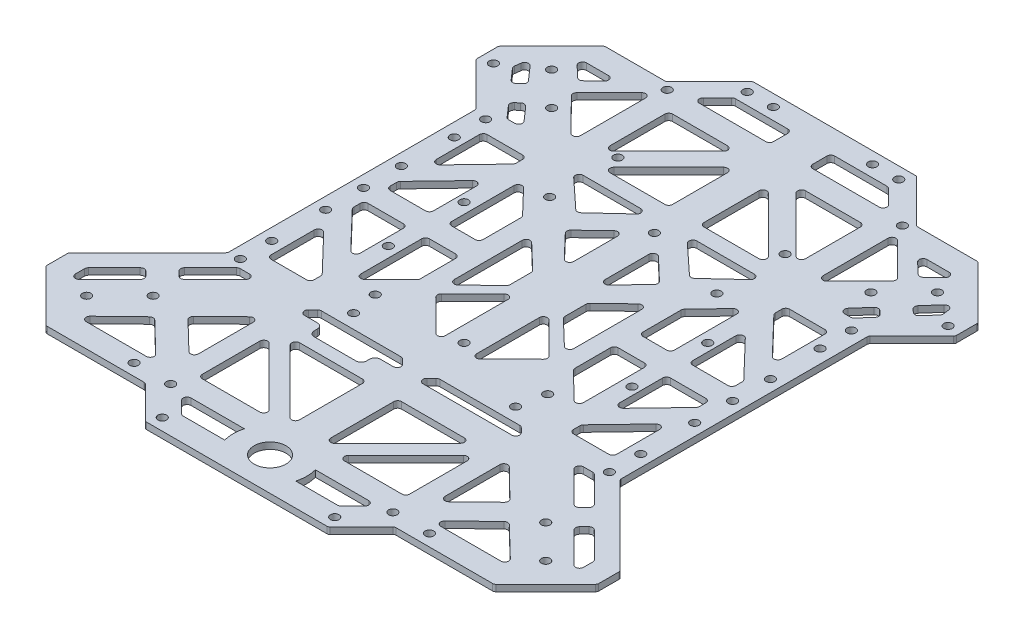
from build123d import *

# Parameters (mm, degrees)
Y_KSEKLIK_EKSTR_ZYON2_DEPTH = 2.5
IZIM2_R                     = 1.65
KES_EKSTR_ZYON1_DEPTH       = 160.16888056
RADYUS1_R                   = 1.17
Y_KSEKLIK_EKSTR_ZYON3_START = -2.5
Y_KSEKLIK_EKSTR_ZYON3_DEPTH = 2.5
IZIM6_R                     = 1.65
KES_EKSTR_ZYON3_DEPTH       = 160.16888056
RADYUS2_R                   = 1.5
KES_EKSTR_ZYON4_DEPTH       = 160.16888056
RADYUS3_R                   = 2
Y_KSEKLIK_EKSTR_ZYON5_START = -2.5
IZIM8_R                     = 6.1
Y_KSEKLIK_EKSTR_ZYON5_DEPTH = 2.5
IZIM9_R                     = 6.1
KES_EKSTR_ZYON5_DEPTH       = 160.16888056


with BuildPart() as part:
    # Çizim1 → Yükseklik-Ekstrüzyon2 (new body)
    with BuildSketch(Plane(origin=(0, 0, 0), x_dir=(1, 0, 0), z_dir=(0, 1, 0))):
        Polygon((105.526911935, -77.905591591), (75.121320344, -47.5), (75.121320344, 0), (75.121320344, 47.5), (91.738329701, 64.117009358), (91.738329701, 72.817009358), (71.444365081, 93.110973978), (47.944365081, 93.110973978), (31.327355724, 109.727983336), (-31.327355724, 109.727983336), (-47.944365081, 93.110973978), (-71.444365081, 93.110973978), (-91.738329701, 72.817009358), (-91.738329701, 64.117009358), (-75.121320344, 47.5), (-75.121320344, 0), (-75.121320344, -47.5), (-105.526911935, -77.905591591), (-105.526911935, -86.605591591), (-85.727922061, -106.404581464), (-47.727922061, -106.404581464), (-35, -119.132503526), (35, -119.132503526), (47.727922061, -106.404581464), (85.727922061, -106.404581464), (105.526911935, -86.605591591), align=None)
        with BuildLine():
            Line((6, -104.132503526), (6, -108.632503526))
            ThreePointArc((6, -108.632503526), (6.439339828, -109.693163697), (7.5, -110.132503526))
            Line((7.5, -110.132503526), (29.5, -110.132503526))
            ThreePointArc((29.5, -110.132503526), (30.074025149, -110.018322824), (30.560660172, -109.693163697))
            Line((30.560660172, -109.693163697), (35.060660172, -105.193163697))
            ThreePointArc((35.060660172, -105.193163697), (35.385819299, -103.558478377), (34, -102.632503526))
            Line((34, -102.632503526), (7.5, -102.632503526))
            ThreePointArc((7.5, -102.632503526), (6.439339828, -103.071843354), (6, -104.132503526))
        make_face(mode=Mode.SUBTRACT)
        with BuildLine():
            Line((39.693257197, -70.632503526), (39.693257197, -92.632503526))
            ThreePointArc((39.693257197, -92.632503526), (39.253917369, -93.693163697), (38.193257197, -94.132503526))
            Line((38.193257197, -94.132503526), (16.193257197, -94.132503526))
            ThreePointArc((16.193257197, -94.132503526), (14.807437899, -93.206528674), (15.132597026, -91.571843354))
            Line((15.132597026, -91.571843354), (37.132597026, -69.571843354))
            ThreePointArc((37.132597026, -69.571843354), (38.767282346, -69.246684227), (39.693257197, -70.632503526))
        make_face(mode=Mode.SUBTRACT)
        with BuildLine():
            Line((6, -65.049314368), (6, -89.132503526))
            ThreePointArc((6, -89.132503526), (6.927173874, -90.518818868), (8.562493639, -90.191327055))
            Line((8.562493639, -90.191327055), (32.562493639, -66.108137897))
            ThreePointArc((32.562493639, -66.108137897), (32.885322218, -64.474090626), (31.5, -63.549314368))
            Line((31.5, -63.549314368), (7.5, -63.549314368))
            ThreePointArc((7.5, -63.549314368), (6.439339828, -63.988654196), (6, -65.049314368))
        make_face(mode=Mode.SUBTRACT)
        with BuildLine():
            Line((66.811266381, -83.702158734), (55.311266381, -94.826456464))
            ThreePointArc((55.311266381, -94.826456464), (54.963632077, -96.467081464), (56.354169294, -97.404581464))
            Line((56.354169294, -97.404581464), (79.354169294, -97.404581464))
            ThreePointArc((79.354169294, -97.404581464), (80.74470651, -96.467081464), (80.397072206, -94.826456464))
            Line((80.397072206, -94.826456464), (68.897072206, -83.702158734))
            ThreePointArc((68.897072206, -83.702158734), (67.854169294, -83.280283734), (66.811266381, -83.702158734))
        make_face(mode=Mode.SUBTRACT)
        with BuildLine():
            Line((49.73616011, -87.697686208), (60.51741011, -77.268657085))
            ThreePointArc((60.51741011, -77.268657085), (60.974498637, -76.195599689), (60.524670942, -75.119478347))
            Line((60.524670942, -75.119478347), (49.743420942, -64.54850747))
            ThreePointArc((49.743420942, -64.54850747), (48.112415402, -64.236585138), (47.193257197, -65.619561208))
            Line((47.193257197, -65.619561208), (47.193257197, -86.619561208))
            ThreePointArc((47.193257197, -86.619561208), (48.107746467, -88.000567067), (49.73616011, -87.697686208))
        make_face(mode=Mode.SUBTRACT)
        with BuildLine():
            Line((21.634440051, -34.045740022), (4.634440051, -50.986814368))
            ThreePointArc((4.634440051, -50.986814368), (4.306940134, -52.62213633), (5.693257197, -53.549314368))
            Line((5.693257197, -53.549314368), (39.693257197, -53.549314368))
            ThreePointArc((39.693257197, -53.549314368), (41.079574261, -52.62213633), (40.752074344, -50.986814368))
            Line((40.752074344, -50.986814368), (23.752074344, -34.045740022))
            ThreePointArc((23.752074344, -34.045740022), (22.693257197, -33.608240022), (21.634440051, -34.045740022))
        make_face(mode=Mode.SUBTRACT)
        with BuildLine():
            Line((6, -9.30780183), (6, -33.30780183))
            ThreePointArc((6, -33.30780183), (6.924776258, -34.693124048), (8.558823529, -34.370295469))
            Line((8.558823529, -34.370295469), (20.600418108, -22.370295469))
            ThreePointArc((20.600418108, -22.370295469), (21.041594579, -21.30780183), (20.600418108, -20.245308191))
            Line((20.600418108, -20.245308191), (8.558823529, -8.245308191))
            ThreePointArc((8.558823529, -8.245308191), (6.924776258, -7.922479612), (6, -9.30780183))
        make_face(mode=Mode.SUBTRACT)
        with BuildLine():
            Line((10.5, 4), (10.5, -4))
            ThreePointArc((10.5, -4), (10.620200683, -4.588348405), (10.961538462, -5.082403637))
            Line((10.961538462, -5.082403637), (20.342369981, -14.082403637))
            ThreePointArc((20.342369981, -14.082403637), (21.969179925, -14.379799317), (22.88083152, -13))
            Line((22.88083152, -13), (22.88083152, 13))
            ThreePointArc((22.88083152, 13), (21.969179925, 14.379799317), (20.342369981, 14.082403637))
            Line((20.342369981, 14.082403637), (10.961538462, 5.082403637))
            ThreePointArc((10.961538462, 5.082403637), (10.620200683, 4.588348405), (10.5, 4))
        make_face(mode=Mode.SUBTRACT)
        with BuildLine():
            Line((84.774621202, -69.174116139), (83.006854249, -70.941883092))
            ThreePointArc((83.006854249, -70.941883092), (82.567514421, -72.002543264), (83.006854249, -73.063203436))
            Line((83.006854249, -73.063203436), (94.674116139, -84.730465325))
            ThreePointArc((94.674116139, -84.730465325), (96.308801459, -85.055624452), (97.234776311, -83.669805153))
            Line((97.234776311, -83.669805153), (97.234776311, -80.134271247))
            ThreePointArc((97.234776311, -80.134271247), (97.12059561, -79.560246099), (96.795436483, -79.073611076))
            Line((96.795436483, -79.073611076), (86.895941546, -69.174116139))
            ThreePointArc((86.895941546, -69.174116139), (85.835281374, -68.734776311), (84.774621202, -69.174116139))
        make_face(mode=Mode.SUBTRACT)
        with BuildLine():
            Line((63.914971157, -50.35), (67.450505063, -50.35))
            ThreePointArc((67.450505063, -50.35), (68.024530212, -50.464180701), (68.511165235, -50.789339828))
            Line((68.511165235, -50.789339828), (78.410660172, -60.688834765))
            ThreePointArc((78.410660172, -60.688834765), (78.85, -61.749494937), (78.410660172, -62.810155108))
            Line((78.410660172, -62.810155108), (76.642893219, -64.577922061))
            ThreePointArc((76.642893219, -64.577922061), (75.582233047, -65.01726189), (74.521572875, -64.577922061))
            Line((74.521572875, -64.577922061), (62.854310986, -52.910660172))
            ThreePointArc((62.854310986, -52.910660172), (62.529151859, -51.275974851), (63.914971157, -50.35))
        make_face(mode=Mode.SUBTRACT)
        with BuildLine():
            Line((51.121320344, -41.35), (64.621320344, -41.35))
            ThreePointArc((64.621320344, -41.35), (65.681980515, -40.910660172), (66.121320344, -39.85))
            Line((66.121320344, -39.85), (66.121320344, -23.35))
            ThreePointArc((66.121320344, -23.35), (65.18096065, -21.958309399), (63.538916707, -22.311538462))
            Line((63.538916707, -22.311538462), (50.038916707, -36.382785741))
            ThreePointArc((50.038916707, -36.382785741), (49.729629743, -36.861606973), (49.621320344, -37.421247279))
            Line((49.621320344, -37.421247279), (49.621320344, -39.85))
            ThreePointArc((49.621320344, -39.85), (50.060660172, -40.910660172), (51.121320344, -41.35))
        make_face(mode=Mode.SUBTRACT)
        with BuildLine():
            Line((49.621320344, -5.754580613), (49.621320344, -22.254580613))
            ThreePointArc((49.621320344, -22.254580613), (50.561680037, -23.646271213), (52.20372398, -23.293042151))
            Line((52.20372398, -23.293042151), (65.70372398, -9.221794872))
            ThreePointArc((65.70372398, -9.221794872), (66.013010944, -8.74297364), (66.121320344, -8.183333333))
            Line((66.121320344, -8.183333333), (66.121320344, -5.754580613))
            ThreePointArc((66.121320344, -5.754580613), (65.681980515, -4.693920441), (64.621320344, -4.254580613))
            Line((64.621320344, -4.254580613), (51.121320344, -4.254580613))
            ThreePointArc((51.121320344, -4.254580613), (50.060660172, -4.693920441), (49.621320344, -5.754580613))
        make_face(mode=Mode.SUBTRACT)
        with BuildLine():
            Line((29.621320344, -5.75), (29.621320344, -19.25))
            ThreePointArc((29.621320344, -19.25), (29.738447975, -19.831088643), (30.071539025, -20.321428571))
            Line((30.071539025, -20.321428571), (40.071539025, -30.119387543))
            ThreePointArc((40.071539025, -30.119387543), (41.702408987, -30.43083134), (42.621320344, -29.047958971))
            Line((42.621320344, -29.047958971), (42.621320344, -5.75))
            ThreePointArc((42.621320344, -5.75), (42.181980515, -4.689339828), (41.121320344, -4.25))
            Line((41.121320344, -4.25), (31.121320344, -4.25))
            ThreePointArc((31.121320344, -4.25), (30.060660172, -4.689339828), (29.621320344, -5.75))
        make_face(mode=Mode.SUBTRACT)
        with BuildLine():
            Line((-41.121320344, -4.25), (-31.121320344, -4.25))
            ThreePointArc((-31.121320344, -4.25), (-30.060660172, -4.689339828), (-29.621320344, -5.75))
            Line((-29.621320344, -5.75), (-29.621320344, -19.25))
            ThreePointArc((-29.621320344, -19.25), (-29.738447975, -19.831088643), (-30.071539025, -20.321428571))
            Line((-30.071539025, -20.321428571), (-40.071539025, -30.119387543))
            ThreePointArc((-40.071539025, -30.119387543), (-41.702408987, -30.43083134), (-42.621320344, -29.047958971))
            Line((-42.621320344, -29.047958971), (-42.621320344, -5.75))
            ThreePointArc((-42.621320344, -5.75), (-42.181980515, -4.689339828), (-41.121320344, -4.25))
        make_face(mode=Mode.SUBTRACT)
        with BuildLine():
            Line((-64.621320344, -4.254580613), (-51.121320344, -4.254580613))
            ThreePointArc((-51.121320344, -4.254580613), (-50.060660172, -4.693920441), (-49.621320344, -5.754580613))
            Line((-49.621320344, -5.754580613), (-49.621320344, -22.254580613))
            ThreePointArc((-49.621320344, -22.254580613), (-50.561680037, -23.646271213), (-52.20372398, -23.293042151))
            Line((-52.20372398, -23.293042151), (-65.70372398, -9.221794872))
            ThreePointArc((-65.70372398, -9.221794872), (-66.013010944, -8.74297364), (-66.121320344, -8.183333333))
            Line((-66.121320344, -8.183333333), (-66.121320344, -5.754580613))
            ThreePointArc((-66.121320344, -5.754580613), (-65.681980515, -4.693920441), (-64.621320344, -4.254580613))
        make_face(mode=Mode.SUBTRACT)
        with BuildLine():
            Line((-49.621320344, -37.421247279), (-49.621320344, -39.85))
            ThreePointArc((-49.621320344, -39.85), (-50.060660172, -40.910660172), (-51.121320344, -41.35))
            Line((-51.121320344, -41.35), (-64.621320344, -41.35))
            ThreePointArc((-64.621320344, -41.35), (-65.681980515, -40.910660172), (-66.121320344, -39.85))
            Line((-66.121320344, -39.85), (-66.121320344, -23.35))
            ThreePointArc((-66.121320344, -23.35), (-65.18096065, -21.958309399), (-63.538916707, -22.311538462))
            Line((-63.538916707, -22.311538462), (-50.038916707, -36.382785741))
            ThreePointArc((-50.038916707, -36.382785741), (-49.729629743, -36.861606973), (-49.621320344, -37.421247279))
        make_face(mode=Mode.SUBTRACT)
        with BuildLine():
            Line((-68.511165235, -50.789339828), (-78.410660172, -60.688834765))
            ThreePointArc((-78.410660172, -60.688834765), (-78.85, -61.749494937), (-78.410660172, -62.810155108))
            Line((-78.410660172, -62.810155108), (-76.642893219, -64.577922061))
            ThreePointArc((-76.642893219, -64.577922061), (-75.582233047, -65.01726189), (-74.521572875, -64.577922061))
            Line((-74.521572875, -64.577922061), (-62.854310986, -52.910660172))
            ThreePointArc((-62.854310986, -52.910660172), (-62.529151859, -51.275974851), (-63.914971157, -50.35))
            Line((-63.914971157, -50.35), (-67.450505063, -50.35))
            ThreePointArc((-67.450505063, -50.35), (-68.024530212, -50.464180701), (-68.511165235, -50.789339828))
        make_face(mode=Mode.SUBTRACT)
        with BuildLine():
            Line((-96.795436483, -79.073611076), (-86.895941546, -69.174116139))
            ThreePointArc((-86.895941546, -69.174116139), (-85.835281374, -68.734776311), (-84.774621202, -69.174116139))
            Line((-84.774621202, -69.174116139), (-83.006854249, -70.941883092))
            ThreePointArc((-83.006854249, -70.941883092), (-82.567514421, -72.002543264), (-83.006854249, -73.063203436))
            Line((-83.006854249, -73.063203436), (-94.674116139, -84.730465325))
            ThreePointArc((-94.674116139, -84.730465325), (-96.308801459, -85.055624452), (-97.234776311, -83.669805153))
            Line((-97.234776311, -83.669805153), (-97.234776311, -80.134271247))
            ThreePointArc((-97.234776311, -80.134271247), (-97.12059561, -79.560246099), (-96.795436483, -79.073611076))
        make_face(mode=Mode.SUBTRACT)
        with BuildLine():
            Line((-10.961538462, -5.082403637), (-20.342369981, -14.082403637))
            ThreePointArc((-20.342369981, -14.082403637), (-21.969179925, -14.379799317), (-22.88083152, -13))
            Line((-22.88083152, -13), (-22.88083152, 13))
            ThreePointArc((-22.88083152, 13), (-21.969179925, 14.379799317), (-20.342369981, 14.082403637))
            Line((-20.342369981, 14.082403637), (-10.961538462, 5.082403637))
            ThreePointArc((-10.961538462, 5.082403637), (-10.620200683, 4.588348405), (-10.5, 4))
            Line((-10.5, 4), (-10.5, -4))
            ThreePointArc((-10.5, -4), (-10.620200683, -4.588348405), (-10.961538462, -5.082403637))
        make_face(mode=Mode.SUBTRACT)
        with BuildLine():
            Line((-20.600418108, -20.245308191), (-8.558823529, -8.245308191))
            ThreePointArc((-8.558823529, -8.245308191), (-6.924776258, -7.922479612), (-6, -9.30780183))
            Line((-6, -9.30780183), (-6, -33.30780183))
            ThreePointArc((-6, -33.30780183), (-6.924776258, -34.693124048), (-8.558823529, -34.370295469))
            Line((-8.558823529, -34.370295469), (-20.600418108, -22.370295469))
            ThreePointArc((-20.600418108, -22.370295469), (-21.041594579, -21.30780183), (-20.600418108, -20.245308191))
        make_face(mode=Mode.SUBTRACT)
        with BuildLine():
            Line((-40.752074344, -50.986814368), (-23.752074344, -34.045740022))
            ThreePointArc((-23.752074344, -34.045740022), (-22.693257197, -33.608240022), (-21.634440051, -34.045740022))
            Line((-21.634440051, -34.045740022), (-4.634440051, -50.986814368))
            ThreePointArc((-4.634440051, -50.986814368), (-4.306940134, -52.62213633), (-5.693257197, -53.549314368))
            Line((-5.693257197, -53.549314368), (-39.693257197, -53.549314368))
            ThreePointArc((-39.693257197, -53.549314368), (-41.079574261, -52.62213633), (-40.752074344, -50.986814368))
        make_face(mode=Mode.SUBTRACT)
        with BuildLine():
            Line((-47.193257197, -65.619561208), (-47.193257197, -86.619561208))
            ThreePointArc((-47.193257197, -86.619561208), (-48.107746467, -88.000567067), (-49.73616011, -87.697686208))
            Line((-49.73616011, -87.697686208), (-60.51741011, -77.268657085))
            ThreePointArc((-60.51741011, -77.268657085), (-60.974498637, -76.195599689), (-60.524670942, -75.119478347))
            Line((-60.524670942, -75.119478347), (-49.743420942, -64.54850747))
            ThreePointArc((-49.743420942, -64.54850747), (-48.112415402, -64.236585138), (-47.193257197, -65.619561208))
        make_face(mode=Mode.SUBTRACT)
        with BuildLine():
            Line((-80.397072206, -94.826456464), (-68.897072206, -83.702158734))
            ThreePointArc((-68.897072206, -83.702158734), (-67.854169294, -83.280283734), (-66.811266381, -83.702158734))
            Line((-66.811266381, -83.702158734), (-55.311266381, -94.826456464))
            ThreePointArc((-55.311266381, -94.826456464), (-54.963632077, -96.467081464), (-56.354169294, -97.404581464))
            Line((-56.354169294, -97.404581464), (-79.354169294, -97.404581464))
            ThreePointArc((-79.354169294, -97.404581464), (-80.74470651, -96.467081464), (-80.397072206, -94.826456464))
        make_face(mode=Mode.SUBTRACT)
        with BuildLine():
            Line((-31.5, -63.549314368), (-7.5, -63.549314368))
            ThreePointArc((-7.5, -63.549314368), (-6.439339828, -63.988654196), (-6, -65.049314368))
            Line((-6, -65.049314368), (-6, -89.132503526))
            ThreePointArc((-6, -89.132503526), (-6.927173874, -90.518818868), (-8.562493639, -90.191327055))
            Line((-8.562493639, -90.191327055), (-32.562493639, -66.108137897))
            ThreePointArc((-32.562493639, -66.108137897), (-32.885322218, -64.474090626), (-31.5, -63.549314368))
        make_face(mode=Mode.SUBTRACT)
        with BuildLine():
            Line((-15.132597026, -91.571843354), (-37.132597026, -69.571843354))
            ThreePointArc((-37.132597026, -69.571843354), (-38.767282346, -69.246684227), (-39.693257197, -70.632503526))
            Line((-39.693257197, -70.632503526), (-39.693257197, -92.632503526))
            ThreePointArc((-39.693257197, -92.632503526), (-39.253917369, -93.693163697), (-38.193257197, -94.132503526))
            Line((-38.193257197, -94.132503526), (-16.193257197, -94.132503526))
            ThreePointArc((-16.193257197, -94.132503526), (-14.807437899, -93.206528674), (-15.132597026, -91.571843354))
        make_face(mode=Mode.SUBTRACT)
        with BuildLine():
            Line((-34, -102.632503526), (-7.5, -102.632503526))
            ThreePointArc((-7.5, -102.632503526), (-6.439339828, -103.071843354), (-6, -104.132503526))
            Line((-6, -104.132503526), (-6, -108.632503526))
            ThreePointArc((-6, -108.632503526), (-6.439339828, -109.693163697), (-7.5, -110.132503526))
            Line((-7.5, -110.132503526), (-29.5, -110.132503526))
            ThreePointArc((-29.5, -110.132503526), (-30.074025149, -110.018322824), (-30.560660172, -109.693163697))
            Line((-30.560660172, -109.693163697), (-35.060660172, -105.193163697))
            ThreePointArc((-35.060660172, -105.193163697), (-35.385819299, -103.558478377), (-34, -102.632503526))
        make_face(mode=Mode.SUBTRACT)
        with BuildLine():
            Line((63.538916707, 22.311538462), (50.038916707, 36.382785741))
            ThreePointArc((50.038916707, 36.382785741), (49.729629743, 36.861606973), (49.621320344, 37.421247279))
            Line((49.621320344, 37.421247279), (49.621320344, 39.85))
            ThreePointArc((49.621320344, 39.85), (50.060660172, 40.910660172), (51.121320344, 41.35))
            Line((51.121320344, 41.35), (64.621320344, 41.35))
            ThreePointArc((64.621320344, 41.35), (65.681980515, 40.910660172), (66.121320344, 39.85))
            Line((66.121320344, 39.85), (66.121320344, 23.35))
            ThreePointArc((66.121320344, 23.35), (65.18096065, 21.958309399), (63.538916707, 22.311538462))
        make_face(mode=Mode.SUBTRACT)
        with BuildLine():
            Line((66.121320344, 8.183333333), (66.121320344, 5.754580613))
            ThreePointArc((66.121320344, 5.754580613), (65.681980515, 4.693920441), (64.621320344, 4.254580613))
            Line((64.621320344, 4.254580613), (51.121320344, 4.254580613))
            ThreePointArc((51.121320344, 4.254580613), (50.060660172, 4.693920441), (49.621320344, 5.754580613))
            Line((49.621320344, 5.754580613), (49.621320344, 22.254580613))
            ThreePointArc((49.621320344, 22.254580613), (50.561680037, 23.646271213), (52.20372398, 23.293042151))
            Line((52.20372398, 23.293042151), (65.70372398, 9.221794872))
            ThreePointArc((65.70372398, 9.221794872), (66.013010944, 8.74297364), (66.121320344, 8.183333333))
        make_face(mode=Mode.SUBTRACT)
        with BuildLine():
            Line((41.121320344, 4.254580613), (32.121320344, 4.254580613))
            ThreePointArc((32.121320344, 4.254580613), (31.060660172, 4.693920441), (30.621320344, 5.754580613))
            Line((30.621320344, 5.754580613), (30.621320344, 20.254580613))
            ThreePointArc((30.621320344, 20.254580613), (30.729629743, 20.814220919), (31.038916707, 21.293042151))
            Line((31.038916707, 21.293042151), (40.038916707, 30.673873671))
            ThreePointArc((40.038916707, 30.673873671), (41.68096065, 31.027102733), (42.621320344, 29.635412132))
            Line((42.621320344, 29.635412132), (42.621320344, 5.754580613))
            ThreePointArc((42.621320344, 5.754580613), (42.181980515, 4.693920441), (41.121320344, 4.254580613))
        make_face(mode=Mode.SUBTRACT)
        with BuildLine():
            Line((62.002327364, 52.842432456), (66.633678823, 58.091297443))
            ThreePointArc((66.633678823, 58.091297443), (67.664868177, 58.595943855), (68.750868062, 58.223621771))
            Line((68.750868062, 58.223621771), (70.025592416, 57.098864988))
            ThreePointArc((70.025592416, 57.098864988), (70.530238828, 56.067675634), (70.157916744, 54.981675749))
            Line((70.157916744, 54.981675749), (66.51899774, 50.857567544))
            ThreePointArc((66.51899774, 50.857567544), (66.011230145, 50.482767634), (65.394240957, 50.35))
            Line((65.394240957, 50.35), (63.127084147, 50.35))
            ThreePointArc((63.127084147, 50.35), (61.759851781, 51.233010812), (62.002327364, 52.842432456))
        make_face(mode=Mode.SUBTRACT)
        with BuildLine():
            Line((78.097376389, 63.979730013), (81.736295393, 68.103838218))
            ThreePointArc((81.736295393, 68.103838218), (82.044954591, 68.654322007), (82.099865458, 69.283041101))
            Line((82.099865458, 69.283041101), (81.817573559, 71.532554668))
            ThreePointArc((81.817573559, 71.532554668), (80.771195378, 72.779200221), (79.204489928, 72.338216695))
            Line((79.204489928, 72.338216695), (74.573138468, 67.089351708))
            ThreePointArc((74.573138468, 67.089351708), (74.200816384, 66.003351823), (74.705462796, 64.972162469))
            Line((74.705462796, 64.972162469), (75.98018715, 63.847405686))
            ThreePointArc((75.98018715, 63.847405686), (77.066187035, 63.475083601), (78.097376389, 63.979730013))
        make_face(mode=Mode.SUBTRACT)
        with BuildLine():
            Line((60.957864376, 84.110973978), (69.357864376, 84.110973978))
            ThreePointArc((69.357864376, 84.110973978), (70.750579413, 83.168059992), (70.392347135, 81.524767081))
            Line((70.392347135, 81.524767081), (66.192347135, 77.524767081))
            ThreePointArc((66.192347135, 77.524767081), (65.157864376, 77.110973978), (64.123381618, 77.524767081))
            Line((64.123381618, 77.524767081), (59.923381618, 81.524767081))
            ThreePointArc((59.923381618, 81.524767081), (59.56514934, 83.168059992), (60.957864376, 84.110973978))
        make_face(mode=Mode.SUBTRACT)
        with BuildLine():
            Line((6, 32.635405306), (6, 15.835405306))
            ThreePointArc((6, 15.835405306), (6.942124127, 14.443006473), (8.585032681, 14.79969102))
            Line((8.585032681, 14.79969102), (16.975952079, 23.590167211))
            ThreePointArc((16.975952079, 23.590167211), (17.390513959, 24.660754868), (16.926633684, 25.710914177))
            Line((16.926633684, 25.710914177), (8.535714286, 33.720437987))
            ThreePointArc((8.535714286, 33.720437987), (6.909903156, 34.014457776), (6, 32.635405306))
        make_face(mode=Mode.SUBTRACT)
        with BuildLine():
            Line((9.730196097, 43.598039027), (20.730196097, 33.4))
            ThreePointArc((20.730196097, 33.4), (21.75, 33), (22.769803903, 33.4))
            Line((22.769803903, 33.4), (33.769803903, 43.598039027))
            ThreePointArc((33.769803903, 43.598039027), (34.146424004, 45.245761585), (32.75, 46.198039027))
            Line((32.75, 46.198039027), (10.75, 46.198039027))
            ThreePointArc((10.75, 46.198039027), (9.353575996, 45.245761585), (9.730196097, 43.598039027))
        make_face(mode=Mode.SUBTRACT)
        with BuildLine():
            Line((9, 100.727983336), (29.009416563, 100.727983336))
            ThreePointArc((29.009416563, 100.727983336), (29.584046334, 100.613552037), (30.071001931, 100.287717503))
            Line((30.071001931, 100.287717503), (35.461585368, 94.887717503))
            ThreePointArc((35.461585368, 94.887717503), (35.785568701, 93.253353564), (34.4, 92.327983336))
            Line((34.4, 92.327983336), (9, 92.327983336))
            ThreePointArc((9, 92.327983336), (7.939339828, 92.767323164), (7.5, 93.827983336))
            Line((7.5, 93.827983336), (7.5, 99.227983336))
            ThreePointArc((7.5, 99.227983336), (7.939339828, 100.288643508), (9, 100.727983336))
        make_face(mode=Mode.SUBTRACT)
        with BuildLine():
            Line((6, 74.698039027), (6, 53.698039027))
            ThreePointArc((6, 53.698039027), (6.439339828, 52.637378855), (7.5, 52.198039027))
            Line((7.5, 52.198039027), (28.5, 52.198039027))
            ThreePointArc((28.5, 52.198039027), (29.885819299, 53.124013879), (29.560660172, 54.758699199))
            Line((29.560660172, 54.758699199), (8.560660172, 75.758699199))
            ThreePointArc((8.560660172, 75.758699199), (6.925974851, 76.083858326), (6, 74.698039027))
        make_face(mode=Mode.SUBTRACT)
        with BuildLine():
            Line((37.424621202, 82.12266023), (37.424621202, 61.12266023))
            ThreePointArc((37.424621202, 61.12266023), (36.498646351, 59.736840931), (34.863961031, 60.062000058))
            Line((34.863961031, 60.062000058), (13.863961031, 81.062000058))
            ThreePointArc((13.863961031, 81.062000058), (13.538801904, 82.696685378), (14.924621202, 83.62266023))
            Line((14.924621202, 83.62266023), (35.924621202, 83.62266023))
            ThreePointArc((35.924621202, 83.62266023), (36.985281374, 83.183320401), (37.424621202, 82.12266023))
        make_face(mode=Mode.SUBTRACT)
        with BuildLine():
            Line((46.424621202, 83.724368671), (46.424621202, 58.824368671))
            ThreePointArc((46.424621202, 58.824368671), (47.354807935, 57.436812243), (48.991704989, 57.770171255))
            Line((48.991704989, 57.770171255), (61.36607366, 70.295802584))
            ThreePointArc((61.36607366, 70.295802584), (61.798982954, 71.354556041), (61.359650045, 72.410660172))
            Line((61.359650045, 72.410660172), (48.985281374, 84.785028843))
            ThreePointArc((48.985281374, 84.785028843), (47.350596054, 85.11018797), (46.424621202, 83.724368671))
        make_face(mode=Mode.SUBTRACT)
        with BuildLine():
            Line((-61.359650045, 72.410660172), (-48.985281374, 84.785028843))
            ThreePointArc((-48.985281374, 84.785028843), (-47.350596054, 85.11018797), (-46.424621202, 83.724368671))
            Line((-46.424621202, 83.724368671), (-46.424621202, 58.824368671))
            ThreePointArc((-46.424621202, 58.824368671), (-47.354807935, 57.436812243), (-48.991704989, 57.770171255))
            Line((-48.991704989, 57.770171255), (-61.36607366, 70.295802584))
            ThreePointArc((-61.36607366, 70.295802584), (-61.798982954, 71.354556041), (-61.359650045, 72.410660172))
        make_face(mode=Mode.SUBTRACT)
        with BuildLine():
            Line((-34.863961031, 60.062000058), (-13.863961031, 81.062000058))
            ThreePointArc((-13.863961031, 81.062000058), (-13.538801904, 82.696685378), (-14.924621202, 83.62266023))
            Line((-14.924621202, 83.62266023), (-35.924621202, 83.62266023))
            ThreePointArc((-35.924621202, 83.62266023), (-36.985281374, 83.183320401), (-37.424621202, 82.12266023))
            Line((-37.424621202, 82.12266023), (-37.424621202, 61.12266023))
            ThreePointArc((-37.424621202, 61.12266023), (-36.498646351, 59.736840931), (-34.863961031, 60.062000058))
        make_face(mode=Mode.SUBTRACT)
        with BuildLine():
            Line((-29.560660172, 54.758699199), (-8.560660172, 75.758699199))
            ThreePointArc((-8.560660172, 75.758699199), (-6.925974851, 76.083858326), (-6, 74.698039027))
            Line((-6, 74.698039027), (-6, 53.698039027))
            ThreePointArc((-6, 53.698039027), (-6.439339828, 52.637378855), (-7.5, 52.198039027))
            Line((-7.5, 52.198039027), (-28.5, 52.198039027))
            ThreePointArc((-28.5, 52.198039027), (-29.885819299, 53.124013879), (-29.560660172, 54.758699199))
        make_face(mode=Mode.SUBTRACT)
        with BuildLine():
            Line((-7.5, 93.827983336), (-7.5, 99.227983336))
            ThreePointArc((-7.5, 99.227983336), (-7.939339828, 100.288643508), (-9, 100.727983336))
            Line((-9, 100.727983336), (-29.009416563, 100.727983336))
            ThreePointArc((-29.009416563, 100.727983336), (-29.584046334, 100.613552037), (-30.071001931, 100.287717503))
            Line((-30.071001931, 100.287717503), (-35.461585368, 94.887717503))
            ThreePointArc((-35.461585368, 94.887717503), (-35.785568701, 93.253353564), (-34.4, 92.327983336))
            Line((-34.4, 92.327983336), (-9, 92.327983336))
            ThreePointArc((-9, 92.327983336), (-7.939339828, 92.767323164), (-7.5, 93.827983336))
        make_face(mode=Mode.SUBTRACT)
        with BuildLine():
            Line((-32.75, 46.198039027), (-10.75, 46.198039027))
            ThreePointArc((-10.75, 46.198039027), (-9.353575996, 45.245761585), (-9.730196097, 43.598039027))
            Line((-9.730196097, 43.598039027), (-20.730196097, 33.4))
            ThreePointArc((-20.730196097, 33.4), (-21.75, 33), (-22.769803903, 33.4))
            Line((-22.769803903, 33.4), (-33.769803903, 43.598039027))
            ThreePointArc((-33.769803903, 43.598039027), (-34.146424004, 45.245761585), (-32.75, 46.198039027))
        make_face(mode=Mode.SUBTRACT)
        with BuildLine():
            Line((-16.926633684, 25.710914177), (-8.535714286, 33.720437987))
            ThreePointArc((-8.535714286, 33.720437987), (-6.909903156, 34.014457776), (-6, 32.635405306))
            Line((-6, 32.635405306), (-6, 15.835405306))
            ThreePointArc((-6, 15.835405306), (-6.942124127, 14.443006473), (-8.585032681, 14.79969102))
            Line((-8.585032681, 14.79969102), (-16.975952079, 23.590167211))
            ThreePointArc((-16.975952079, 23.590167211), (-17.390513959, 24.660754868), (-16.926633684, 25.710914177))
        make_face(mode=Mode.SUBTRACT)
        with BuildLine():
            Line((-64.123381618, 77.524767081), (-59.923381618, 81.524767081))
            ThreePointArc((-59.923381618, 81.524767081), (-59.56514934, 83.168059992), (-60.957864376, 84.110973978))
            Line((-60.957864376, 84.110973978), (-69.357864376, 84.110973978))
            ThreePointArc((-69.357864376, 84.110973978), (-70.750579413, 83.168059992), (-70.392347135, 81.524767081))
            Line((-70.392347135, 81.524767081), (-66.192347135, 77.524767081))
            ThreePointArc((-66.192347135, 77.524767081), (-65.157864376, 77.110973978), (-64.123381618, 77.524767081))
        make_face(mode=Mode.SUBTRACT)
        with BuildLine():
            Line((-82.099865458, 69.283041101), (-81.817573559, 71.532554668))
            ThreePointArc((-81.817573559, 71.532554668), (-80.771195378, 72.779200221), (-79.204489928, 72.338216695))
            Line((-79.204489928, 72.338216695), (-74.573138468, 67.089351708))
            ThreePointArc((-74.573138468, 67.089351708), (-74.200816384, 66.003351823), (-74.705462796, 64.972162469))
            Line((-74.705462796, 64.972162469), (-75.98018715, 63.847405686))
            ThreePointArc((-75.98018715, 63.847405686), (-77.066187035, 63.475083601), (-78.097376389, 63.979730013))
            Line((-78.097376389, 63.979730013), (-81.736295393, 68.103838218))
            ThreePointArc((-81.736295393, 68.103838218), (-82.044954591, 68.654322007), (-82.099865458, 69.283041101))
        make_face(mode=Mode.SUBTRACT)
        with BuildLine():
            Line((-42.621320344, 29.635412132), (-42.621320344, 5.754580613))
            ThreePointArc((-42.621320344, 5.754580613), (-42.181980515, 4.693920441), (-41.121320344, 4.254580613))
            Line((-41.121320344, 4.254580613), (-32.121320344, 4.254580613))
            ThreePointArc((-32.121320344, 4.254580613), (-31.060660172, 4.693920441), (-30.621320344, 5.754580613))
            Line((-30.621320344, 5.754580613), (-30.621320344, 20.254580613))
            ThreePointArc((-30.621320344, 20.254580613), (-30.729629743, 20.814220919), (-31.038916707, 21.293042151))
            Line((-31.038916707, 21.293042151), (-40.038916707, 30.673873671))
            ThreePointArc((-40.038916707, 30.673873671), (-41.68096065, 31.027102733), (-42.621320344, 29.635412132))
        make_face(mode=Mode.SUBTRACT)
        with BuildLine():
            Line((-64.621320344, 4.254580613), (-51.121320344, 4.254580613))
            ThreePointArc((-51.121320344, 4.254580613), (-50.060660172, 4.693920441), (-49.621320344, 5.754580613))
            Line((-49.621320344, 5.754580613), (-49.621320344, 22.254580613))
            ThreePointArc((-49.621320344, 22.254580613), (-50.561680037, 23.646271213), (-52.20372398, 23.293042151))
            Line((-52.20372398, 23.293042151), (-65.70372398, 9.221794872))
            ThreePointArc((-65.70372398, 9.221794872), (-66.013010944, 8.74297364), (-66.121320344, 8.183333333))
            Line((-66.121320344, 8.183333333), (-66.121320344, 5.754580613))
            ThreePointArc((-66.121320344, 5.754580613), (-65.681980515, 4.693920441), (-64.621320344, 4.254580613))
        make_face(mode=Mode.SUBTRACT)
        with BuildLine():
            Line((-49.621320344, 37.421247279), (-49.621320344, 39.85))
            ThreePointArc((-49.621320344, 39.85), (-50.060660172, 40.910660172), (-51.121320344, 41.35))
            Line((-51.121320344, 41.35), (-64.621320344, 41.35))
            ThreePointArc((-64.621320344, 41.35), (-65.681980515, 40.910660172), (-66.121320344, 39.85))
            Line((-66.121320344, 39.85), (-66.121320344, 23.35))
            ThreePointArc((-66.121320344, 23.35), (-65.18096065, 21.958309399), (-63.538916707, 22.311538462))
            Line((-63.538916707, 22.311538462), (-50.038916707, 36.382785741))
            ThreePointArc((-50.038916707, 36.382785741), (-49.729629743, 36.861606973), (-49.621320344, 37.421247279))
        make_face(mode=Mode.SUBTRACT)
        with BuildLine():
            Line((-70.157916744, 54.981675749), (-66.51899774, 50.857567544))
            ThreePointArc((-66.51899774, 50.857567544), (-66.011230145, 50.482767634), (-65.394240957, 50.35))
            Line((-65.394240957, 50.35), (-63.127084147, 50.35))
            ThreePointArc((-63.127084147, 50.35), (-61.759851781, 51.233010812), (-62.002327364, 52.842432456))
            Line((-62.002327364, 52.842432456), (-66.633678823, 58.091297443))
            ThreePointArc((-66.633678823, 58.091297443), (-67.664868177, 58.595943855), (-68.750868062, 58.223621771))
            Line((-68.750868062, 58.223621771), (-70.025592416, 57.098864988))
            ThreePointArc((-70.025592416, 57.098864988), (-70.530238828, 56.067675634), (-70.157916744, 54.981675749))
        make_face(mode=Mode.SUBTRACT)
    extrude(amount=Y_KSEKLIK_EKSTR_ZYON2_DEPTH)

    # Çizim2 → Kes-Ekstrüzyon1 (cut, through all)
    with BuildSketch(Plane(origin=(0, 2.5, 0), x_dir=(1, 0, 0), z_dir=(0, 1, 0))):
        with Locations(Location((-29, 105.227983336, 0), (0, 0, 270))):
            Circle(IZIM2_R)
        with Locations(Location((-45, 90.610973978, 0), (0, 0, 270))):
            Circle(IZIM2_R)
        with Locations(Location((0, 40.727983336, 0), (0, 0, 270))):
            Circle(IZIM2_R)
        with Locations(Location((-73.820243866, 75.192888143, 0), (0, 0, 270))):
            Circle(IZIM2_R)
        with Locations(Location((-61.092321805, 62.464966081, 0), (0, 0, 270))):
            Circle(IZIM2_R)
        with Locations(Location((-87, 66.110973978, 0), (0, 0, 270))):
            Circle(IZIM2_R)
        with Locations(Location((-70, 46.110973978, 0), (0, 0, 270))):
            Circle(IZIM2_R)
        with Locations(Location((-70, 34.110973978, 0), (0, 0, 270))):
            Circle(IZIM2_R)
        with Locations(Location((-70.621320344, 0, 0), (0, 0, 270))):
            Circle(IZIM2_R)
        with Locations(Location((70, 34.110973978, 0), (0, 0, 90))):
            Circle(IZIM2_R)
        with Locations(Location((70, 46.110973978, 0), (0, 0, 90))):
            Circle(IZIM2_R)
        with Locations(Location((87, 66.110973978, 0), (0, 0, 90))):
            Circle(IZIM2_R)
        with Locations(Location((61.092321805, 62.464966081, 0), (0, 0, 90))):
            Circle(IZIM2_R)
        with Locations(Location((73.820243866, 75.192888143, 0), (0, 0, 90))):
            Circle(IZIM2_R)
        with Locations(Location((45, 90.610973978, 0), (0, 0, 90))):
            Circle(IZIM2_R)
        with Locations(Location((29, 105.227983336, 0), (0, 0, 90))):
            Circle(IZIM2_R)
        with Locations(Location((70.621320344, 0, 0), (0, 0, 90))):
            Circle(IZIM2_R)
        with Locations(Location((-32, 32.610973978, 0), (0, 0, 270))):
            Circle(IZIM2_R)
        with Locations(Location((32, 32.610973978, 0), (0, 0, 90))):
            Circle(IZIM2_R)
        with Locations(Location((-33, -114.632503526, 0), (0, 0, 270))):
            Circle(IZIM2_R)
        with Locations(Location((-70.621320344, -35.132503526, 0), (0, 0, 270))):
            Circle(IZIM2_R)
        with Locations(Location((0, -32.132503526, 0), (0, 0, 270))):
            Circle(IZIM2_R)
        with Locations(Location((-75.128391411, -76.006060941, 0), (0, 0, 270))):
            Circle(IZIM2_R)
        with Locations(Location((-87.856313473, -88.733983002, 0), (0, 0, 270))):
            Circle(IZIM2_R)
        with Locations(Location((-56.526911935, -101.904581464, 0), (0, 0, 270))):
            Circle(IZIM2_R)
        with Locations(Location((-42.526911935, -101.904581464, 0), (0, 0, 270))):
            Circle(IZIM2_R)
        with Locations(Location((-70.621320344, -47.132503526, 0), (0, 0, 270))):
            Circle(IZIM2_R)
        with Locations(Location((70.621320344, -47.132503526, 0), (0, 0, 90))):
            Circle(IZIM2_R)
        with Locations(Location((42.526911935, -101.904581464, 0), (0, 0, 90))):
            Circle(IZIM2_R)
        with Locations(Location((56.526911935, -101.904581464, 0), (0, 0, 90))):
            Circle(IZIM2_R)
        with Locations(Location((87.856313473, -88.733983002, 0), (0, 0, 90))):
            Circle(IZIM2_R)
        with Locations(Location((75.128391411, -76.006060941, 0), (0, 0, 90))):
            Circle(IZIM2_R)
        with Locations(Location((70.621320344, -35.132503526, 0), (0, 0, 90))):
            Circle(IZIM2_R)
        with Locations(Location((33, -114.632503526, 0), (0, 0, 90))):
            Circle(IZIM2_R)
        with Locations(Location((-33, -33.132503526, 0), (0, 0, 270))):
            Circle(IZIM2_R)
        with Locations(Location((33, -33.132503526, 0), (0, 0, 90))):
            Circle(IZIM2_R)
    extrude(amount=-KES_EKSTR_ZYON1_DEPTH, mode=Mode.SUBTRACT)

    # Radyus1
    radyus1_edges = [part.edges().sort_by_distance(p)[0] for p in [
        (-91.738329701, 1.25, -64.117009358),
        (-91.738329701, 1.25, -72.817009358),
        (-71.444365081, 1.25, -93.110973978),
        (-47.944365081, 1.25, -93.110973978),
        (-31.327355724, 1.25, -109.727983336),
        (31.327355724, 1.25, -109.727983336),
        (47.944365081, 1.25, -93.110973978),
        (71.444365081, 1.25, -93.110973978),
        (91.738329701, 1.25, -72.817009358),
        (91.738329701, 1.25, -64.117009358),
        (75.121320344, 1.25, -47.5),
        (75.121320344, 1.25, 47.5),
        (105.526911935, 1.25, 77.905591591),
        (105.526911935, 1.25, 86.605591591),
        (85.727922061, 1.25, 106.404581464),
        (47.727922061, 1.25, 106.404581464),
        (35, 1.25, 119.132503526),
        (-35, 1.25, 119.132503526),
        (-47.727922061, 1.25, 106.404581464),
        (-85.727922061, 1.25, 106.404581464),
        (-105.526911935, 1.25, 86.605591591),
        (-105.526911935, 1.25, 77.905591591),
        (-75.121320344, 1.25, 47.5),
        (-75.121320344, 1.25, -47.5),
    ]]
    fillet(radyus1_edges, radius=RADYUS1_R)

    # Çizim4 → Yükseklik-Ekstrüzyon3 (add)
    with BuildSketch(Plane(origin=(0, 2.5, 0), x_dir=(1, 0, 0), z_dir=(0, 1, 0)).offset(Y_KSEKLIK_EKSTR_ZYON3_START)):
        with BuildLine():
            Line((38.556965625, -48.799314368), (23.752074344, -34.045740022))
            ThreePointArc((23.752074344, -34.045740022), (22.693257197, -33.608240022), (21.634440051, -34.045740022))
            Line((21.634440051, -34.045740022), (6.829548769, -48.799314368))
            Line((6.829548769, -48.799314368), (38.556965625, -48.799314368))
        make_face()
        with BuildLine():
            Line((-21.634440051, -34.045740022), (-6.829548769, -48.799314368))
            Line((-6.829548769, -48.799314368), (-38.556965625, -48.799314368))
            Line((-38.556965625, -48.799314368), (-23.752074344, -34.045740022))
            ThreePointArc((-23.752074344, -34.045740022), (-22.693257197, -33.608240022), (-21.634440051, -34.045740022))
        make_face()
    extrude(amount=Y_KSEKLIK_EKSTR_ZYON3_DEPTH)

    # Çizim6 → Kes-Ekstrüzyon3 (cut, through all)
    with BuildSketch(Plane(origin=(0, 2.5, 0), x_dir=(1, 0, 0), z_dir=(0, 1, 0))):
        with Locations(Location((-29, 105.227983336, 0), (0, 0, 270))):
            Circle(IZIM6_R)
        with Locations(Location((-70.621320344, -14.5, 0), (0, 0, 270))):
            Circle(IZIM6_R)
        with Locations(Location((-31, -43.404581464, 0), (0, 0, 270))):
            Circle(IZIM6_R)
        with Locations(Location((19, 105.227983336, 0), (0, 0, 270))):
            Circle(IZIM6_R)
        with Locations(Location((-19, 105.227983336, 0), (0, 0, 270))):
            Circle(IZIM6_R)
        with Locations(Location((70.621320344, 14.5, 0), (0, 0, 270))):
            Circle(IZIM6_R)
        with Locations(Location((46.621320344, 14.5, 0), (0, 0, 270))):
            Circle(IZIM6_R)
        with Locations(Location((46.621320344, -14.5, 0), (0, 0, 270))):
            Circle(IZIM6_R)
        with Locations(Location((-46.621320344, -14.5, 0), (0, 0, 270))):
            Circle(IZIM6_R)
        with Locations(Location((-46.621320344, 14.5, 0), (0, 0, 270))):
            Circle(IZIM6_R)
        with Locations(Location((-70.621320344, 14.5, 0), (0, 0, 270))):
            Circle(IZIM6_R)
        with Locations(Location((70.621320344, -14.5, 0), (0, 0, 270))):
            Circle(IZIM6_R)
        with Locations(Location((-32, 58.727983336, 0), (0, 0, 270))):
            Circle(IZIM6_R)
        with Locations(Location((31, -43.404581464, 0), (0, 0, 270))):
            Circle(IZIM6_R)
        with Locations(Location((32, 58.727983336, 0), (0, 0, 270))):
            Circle(IZIM6_R)
    extrude(amount=-KES_EKSTR_ZYON3_DEPTH, mode=Mode.SUBTRACT)

    # Radyus2
    radyus2_edges = [part.edges().sort_by_distance(p)[0] for p in [
        (38.556965625, 1.25, 48.799314368),
        (6.829548769, 1.25, 48.799314368),
        (-6.829548769, 1.25, 48.799314368),
        (-38.556965625, 1.25, 48.799314368),
    ]]
    fillet(radyus2_edges, radius=RADYUS2_R)

    # Çizim7 → Kes-Ekstrüzyon4 (cut, through all)
    with BuildSketch(Plane(origin=(0, 2.5, 0), x_dir=(1, 0, 0), z_dir=(0, 1, 0))):
        with BuildLine():
            Line((-12.693257197, -53.549314368), (-32.693257197, -53.549314368))
            Line((-32.693257197, -53.549314368), (-32.693257197, -56.799314368))
            ThreePointArc((-32.693257197, -56.799314368), (-32.10747076, -58.21352793), (-30.693257197, -58.799314368))
            Line((-30.693257197, -58.799314368), (-14.693257197, -58.799314368))
            ThreePointArc((-14.693257197, -58.799314368), (-13.279043635, -58.21352793), (-12.693257197, -56.799314368))
            Line((-12.693257197, -56.799314368), (-12.693257197, -53.549314368))
        make_face()
    extrude(amount=-KES_EKSTR_ZYON4_DEPTH, mode=Mode.SUBTRACT)

    # Radyus3
    radyus3_edges = [part.edges().sort_by_distance(p)[0] for p in [
        (-12.693257197, 1.25, 53.549314368),
        (-32.693257197, 1.25, 53.549314368),
    ]]
    fillet(radyus3_edges, radius=RADYUS3_R)

    # Çizim8 → Yükseklik-Ekstrüzyon5 (add)
    with BuildSketch(Plane(origin=(0, 2.5, 0), x_dir=(1, 0, 0), z_dir=(0, 1, 0)).offset(Y_KSEKLIK_EKSTR_ZYON5_START)):
        with Locations((0, -106.382503526)):
            Circle(IZIM8_R)
        with BuildLine():
            Line((13.592185255, -102.632503526), (7.5, -102.632503526))
            ThreePointArc((7.5, -102.632503526), (6.439339828, -103.071843354), (6, -104.132503526))
            Line((6, -104.132503526), (6, -108.632503526))
            ThreePointArc((6, -108.632503526), (6.439339828, -109.693163697), (7.5, -110.132503526))
            Line((7.5, -110.132503526), (13.592185255, -110.132503526))
            ThreePointArc((13.592185255, -110.132503526), (14.1, -106.382503526), (13.592185255, -102.632503526))
        make_face()
        with BuildLine():
            Line((6, -105.282503526), (6, -107.482503526))
            ThreePointArc((6, -107.482503526), (6.074948559, -106.934771576), (6.1, -106.382503526))
            ThreePointArc((6.1, -106.382503526), (6.074948559, -105.830235475), (6, -105.282503526))
        make_face()
        with BuildLine():
            Line((-13.592185255, -102.632503526), (-7.5, -102.632503526))
            ThreePointArc((-7.5, -102.632503526), (-6.439339828, -103.071843354), (-6, -104.132503526))
            Line((-6, -104.132503526), (-6, -108.632503526))
            ThreePointArc((-6, -108.632503526), (-6.439339828, -109.693163697), (-7.5, -110.132503526))
            Line((-7.5, -110.132503526), (-13.592185255, -110.132503526))
            ThreePointArc((-13.592185255, -110.132503526), (-14.1, -106.382503526), (-13.592185255, -102.632503526))
        make_face()
        with BuildLine():
            ThreePointArc((-6, -105.282503526), (-6.1, -106.382503526), (-6, -107.482503526))
            Line((-6, -107.482503526), (-6, -105.282503526))
        make_face()
    extrude(amount=Y_KSEKLIK_EKSTR_ZYON5_DEPTH)

    # Çizim9 → Kes-Ekstrüzyon5 (cut, through all)
    with BuildSketch(Plane(origin=(0, 2.5, 0), x_dir=(1, 0, 0), z_dir=(0, 1, 0))):
        with Locations(Location((0, -106.382503526, 0), (0, 0, 270))):
            Circle(IZIM9_R)
    extrude(amount=-KES_EKSTR_ZYON5_DEPTH, mode=Mode.SUBTRACT)


solid = part.part
